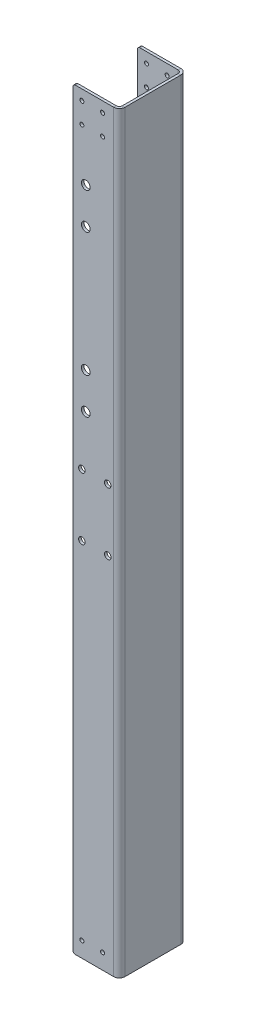
from build123d import *

# Parameters (mm, degrees)
SKETCH1_W                        = 76.2
SKETCH1_H                        = 925.5125
BASE_FLANGE1_DEPTH               = 3.175
EDGE_FLANGE1_STRIP_W             = 20.32
EDGE_FLANGE1_STRIP_H             = 3.175
EDGE_FLANGE1_STRIP_CUT_DEPTH     = 925.5125
EDGE_FLANGE1_DEPTH               = 925.5125
EDGE_FLANGE2_STRIP_W             = 20.32
EDGE_FLANGE2_STRIP_H             = 3.175
EDGE_FLANGE2_STRIP_CUT_DEPTH     = 925.5125
EDGE_FLANGE2_DEPTH               = 925.5125
F_10_0_1935_DIAMETER_HOLE2_D     = 4.9149
F_10_0_1935_DIAMETER_HOLE1_D     = 4.9149
FILLET1_R                        = 3.175
O_0_316_DIAMETER_HOLE1_D         = 8.0264
F_27_64_0_42188_DIAMETER_HOLE1_D = 10.715752


# Sheet-metal steps are written as plain solids
with BuildPart() as part:
    # Sketch1 → Base-Flange1 (new body)
    with BuildSketch(Plane(origin=(0, 0, 0), x_dir=(0, 0, -1), z_dir=(1, 0, 0))):
        with Locations((38.1, 462.75625)):
            Rectangle(SKETCH1_W, SKETCH1_H)
    extrude(amount=-BASE_FLANGE1_DEPTH)

    # Edge-Flange1 strip (across the edge) → Edge-Flange1 strip cut (cut)
    with BuildSketch(Plane(origin=(-3.175, 0, 0), x_dir=(0, 0, -1), z_dir=(0, 1, 0))):
        with Locations((-6.35, -1.5875)):
            Rectangle(EDGE_FLANGE1_STRIP_W, EDGE_FLANGE1_STRIP_H)
    extrude(amount=EDGE_FLANGE1_STRIP_CUT_DEPTH, mode=Mode.SUBTRACT)

    # Edge-Flange1 section (across the edge) → Edge-Flange1 (add)
    with BuildSketch(Plane(origin=(-3.175, 0, 0), x_dir=(0, 0, -1), z_dir=(0, 1, 0))):
        with BuildLine():
            Line((-3.175, 3.81), (-3.175, 53.975))
            Line((-3.175, 53.975), (0, 53.975))
            Line((0, 53.975), (0, 3.81))
            ThreePointArc((0, 3.81), (1.115923164, 1.115923164), (3.81, 0))
            Line((3.81, 0), (3.81, -3.175))
            ThreePointArc((3.81, -3.175), (-1.129140867, -1.129140867), (-3.175, 3.81))
        make_face()
    extrude(amount=EDGE_FLANGE1_DEPTH)

    # Edge-Flange2 strip (across the edge) → Edge-Flange2 strip cut (cut)
    with BuildSketch(Plane(origin=(-3.175, 925.5125, -76.2), x_dir=(0, 0, 1), z_dir=(0, -1, 0))):
        with Locations((-6.35, -1.5875)):
            Rectangle(EDGE_FLANGE2_STRIP_W, EDGE_FLANGE2_STRIP_H)
    extrude(amount=EDGE_FLANGE2_STRIP_CUT_DEPTH, mode=Mode.SUBTRACT)

    # Edge-Flange2 section (across the edge) → Edge-Flange2 (add)
    with BuildSketch(Plane(origin=(-3.175, 925.5125, -76.2), x_dir=(0, 0, 1), z_dir=(0, -1, 0))):
        with BuildLine():
            Line((-3.175, 3.81), (-3.175, 53.975))
            Line((-3.175, 53.975), (0, 53.975))
            Line((0, 53.975), (0, 3.81))
            ThreePointArc((0, 3.81), (1.115923164, 1.115923164), (3.81, 0))
            Line((3.81, 0), (3.81, -3.175))
            ThreePointArc((3.81, -3.175), (-1.129140867, -1.129140867), (-3.175, 3.81))
        make_face()
    extrude(amount=EDGE_FLANGE2_DEPTH)

    # #10 (0.1935) Diameter Hole2 (through all)
    with Locations(Plane(origin=(0, 0, -79.375), x_dir=(-1, 0, 0), z_dir=(0, 0, -1))):
        with Locations((20.6375, 19.05), (46.0375, 19.05)):
            Hole(F_10_0_1935_DIAMETER_HOLE2_D / 2)

    # #10 (0.1935) Diameter Hole1 (through all)
    with Locations(Plane(origin=(0, 0, -79.375), x_dir=(-1, 0, 0), z_dir=(0, 0, -1))):
        with Locations((46.0375, 912.8125), (20.6375, 912.8125), (20.6375, 887.4125), (46.0375, 887.4125)):
            Hole(F_10_0_1935_DIAMETER_HOLE1_D / 2)

    # Fillet1
    fillet1_edges = [part.edges().sort_by_distance(p)[0] for p in [
        (-57.15, 0, 1.5875),
        (-57.15, 925.5125, 1.5875),
        (-57.15, 925.5125, -77.7875),
        (-57.15, 0, -77.7875),
    ]]
    fillet(fillet1_edges, radius=FILLET1_R)

    # O (0.316) Diameter Hole1 (through all)
    with Locations(Plane(origin=(0, 0, -79.375), x_dir=(-1, 0, 0), z_dir=(0, 0, -1))):
        with Locations((14.2875, 520.7), (14.2875, 444.5), (46.0375, 520.7), (46.0375, 444.5)):
            Hole(O_0_316_DIAMETER_HOLE1_D / 2)

    # 27/64 (0.42188) Diameter Hole1 (through all)
    with Locations(Plane.XY.offset(3.175)):
        with Locations((-41.275, 825.5), (-41.275, 781.05), (-41.275, 628.65), (-41.275, 584.2)):
            Hole(F_27_64_0_42188_DIAMETER_HOLE1_D / 2)


solid = part.part
